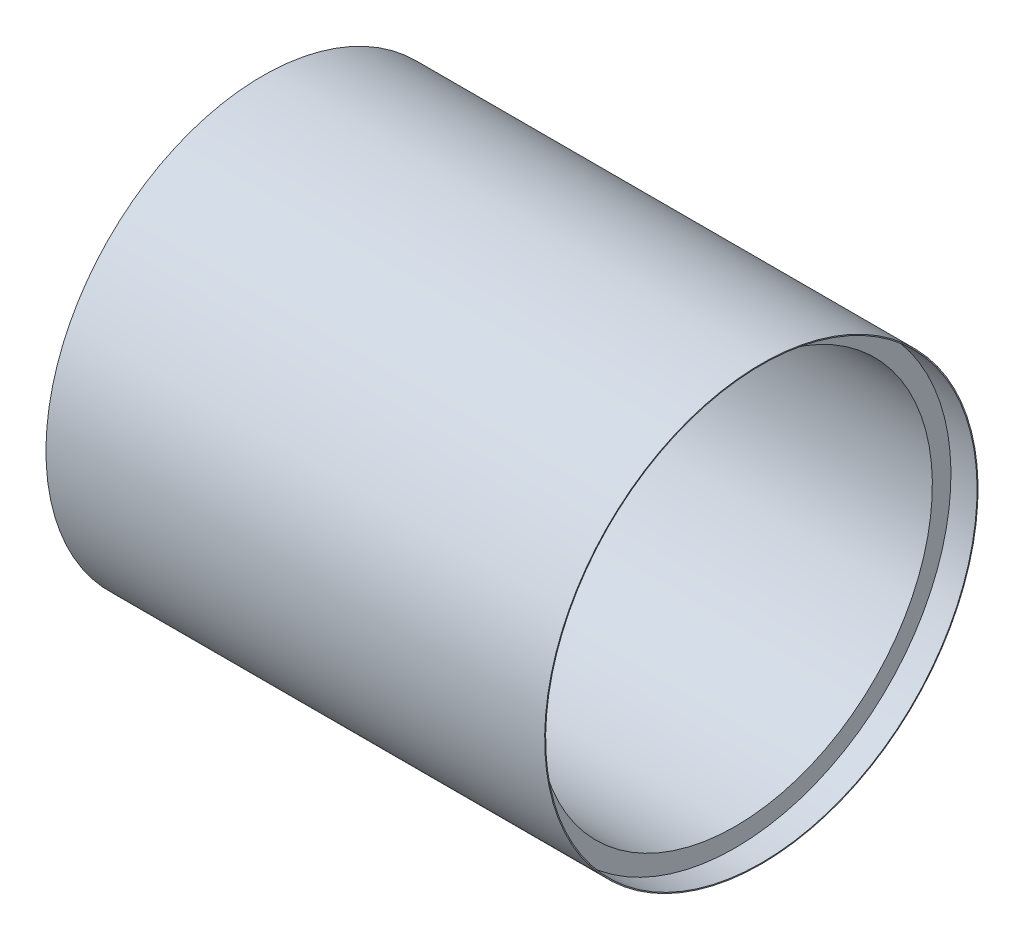
from build123d import *


with BuildPart() as part:
    # Sketch1 → Revolve1 (revolve)
    with BuildSketch(Plane.XY):
        Polygon((39.146309032, 84.3534), (39.146309032, 83.9724), (49.306309032, 83.9724), (49.306309032, 76.7334), (223.118509032, 76.7334), (223.118509032, 83.9724), (233.278509032, 83.9724), (233.278509032, 84.3534), align=None)
    revolve(axis=Axis((0, 0, 0), (1, 0, 0)))


solid = part.part
